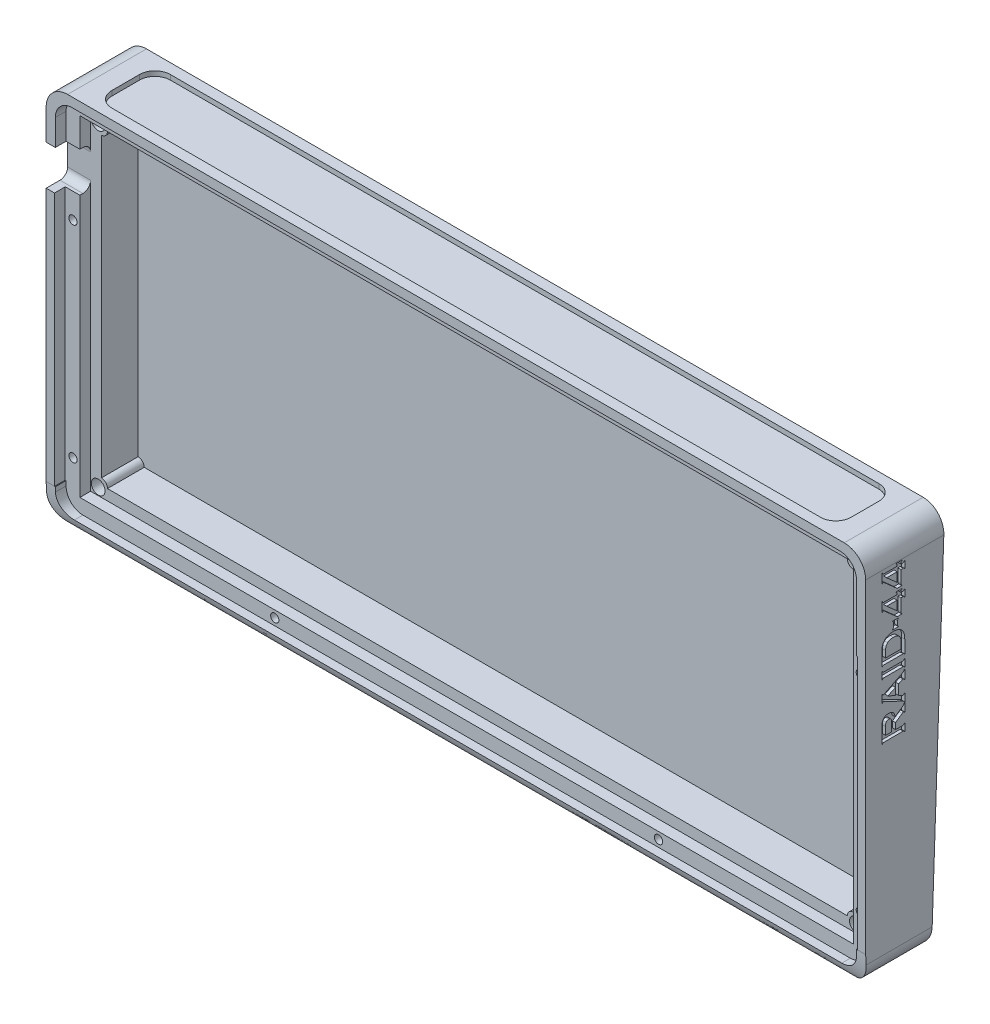
from build123d import *

# Parameters (mm, degrees)
SKETCH2_W           = 267.505
SKETCH2_H           = 122.92
SKETCH2_W_2         = 261.505
SKETCH2_H_2         = 116.92
BOSS_EXTRUDE1_DEPTH = 7
SKETCH3_W           = 267.505
SKETCH3_H           = 122.92
SKETCH3_W_2         = 245.505
SKETCH3_H_2         = 100.92
BOSS_EXTRUDE2_DEPTH = 12
SKETCH4_R           = 2.25
CUT_EXTRUDE1_DEPTH  = 6.1
SKETCH5_W           = 267.505
SKETCH5_H           = 122.92
BOSS_EXTRUDE3_DEPTH = 7
CHAMFER1_SIZE       = 4.539700034
CHAMFER1_SIZE_2     = 130
FILLET1_R           = 7
FILLET2_R           = 5.5
FILLET3_START       = -13
FILLET3_DEPTH       = 6.9
FILLET3_START_2     = -6.1
FILLET3_2_DEPTH     = 6.1
SKETCH6_W           = 3
SKETCH6_H           = 13
CUT_EXTRUDE2_DEPTH  = 7
FILLET4_R           = 2
BOSS_EXTRUDE4_START = 3.5
BOSS_EXTRUDE4_DEPTH = 3.5
FILLET6_SIZE        = 10
FILLET6_SIZE_2      = 2.5
SKETCH15_R          = 1.35
CUT_EXTRUDE5_DEPTH  = 6.1
FILLET7_R           = 2.5
CUT_EXTRUDE6_DEPTH  = 1.5875
CUT_EXTRUDE7_DEPTH  = 1
SKETCH18_W          = 0.273324365
SKETCH18_H          = 82.92
CUT_EXTRUDE8_DEPTH  = 3.5
BOSS_EXTRUDE5_START = -12
BOSS_EXTRUDE5_DEPTH = 12


with BuildPart() as part:
    # Sketch2 → Boss-Extrude1 (new body)
    with BuildSketch(Plane.XY):
        with Locations((-147.6225, -94.77)):
            Rectangle(SKETCH2_W, SKETCH2_H)
        with Locations((-147.6225, -94.77)):
            Rectangle(SKETCH2_W_2, SKETCH2_H_2, mode=Mode.SUBTRACT)
    extrude(amount=BOSS_EXTRUDE1_DEPTH)

    # Sketch3 → Boss-Extrude2 (add)
    with BuildSketch(Plane(origin=(0, 0, 0), x_dir=(-1, 0, 0), z_dir=(0, 0, -1))):
        with Locations((147.6225, -94.77)):
            Rectangle(SKETCH3_W, SKETCH3_H)
        with Locations((147.6225, -94.77)):
            Rectangle(SKETCH3_W_2, SKETCH3_H_2, mode=Mode.SUBTRACT)
    extrude(amount=BOSS_EXTRUDE2_DEPTH)

    # Sketch4 → Cut-Extrude1 (cut)
    with BuildSketch(Plane.XY):
        with Locations((-271.4, -43.3)):
            Circle(SKETCH4_R)
        with Locations((-23.9, -43.4)):
            Circle(SKETCH4_R)
        with Locations((-23.9, -146.3)):
            Circle(SKETCH4_R)
        with Locations((-271.4, -146.3)):
            Circle(SKETCH4_R)
    extrude(amount=-CUT_EXTRUDE1_DEPTH, mode=Mode.SUBTRACT)

    # Sketch5 → Boss-Extrude3 (add)
    with BuildSketch(Plane(origin=(0, 0, -12), x_dir=(-1, 0, 0), z_dir=(0, 0, -1))):
        with Locations((147.6225, -94.77)):
            Rectangle(SKETCH5_W, SKETCH5_H)
    extrude(amount=BOSS_EXTRUDE3_DEPTH)

    # Chamfer1
    # the kernel refuses this chamfer: 130, 4.539700034 mm, written as the material it takes off along each edge
    with BuildSketch(Plane(origin=(324.122385252, -156.23, -19), x_dir=(0, 0, 1), z_dir=(-1, 0, 0))) as chamfer1_piece_1:
        Polygon((CHAMFER1_SIZE, 0), (0, CHAMFER1_SIZE_2), (0, 0), align=None)
    extrude(amount=943.489770504, mode=Mode.SUBTRACT)

    # Fillet1
    fillet1_edges = [part.edges().sort_by_distance(p)[0] for p in [
        (-281.375, -33.31, -5.876380476),
        (-13.87, -33.31, -5.876380476),
        (-13.87, -156.23, -3.730149983),
        (-281.375, -156.23, -3.730149983),
    ]]
    fillet(fillet1_edges, radius=FILLET1_R)

    # Fillet2
    fillet2_edges = [part.edges().sort_by_distance(p)[0] for p in [
        (-278.375, -36.31, 3.5),
        (-278.375, -153.23, 3.5),
        (-16.87, -153.23, 3.5),
        (-16.87, -36.31, 3.5),
    ]]
    fillet(fillet2_edges, radius=FILLET2_R)

    # Fillet3: read off the stored shape, not the designer's step
    # Fillet3 outline → Fillet3 (add)
    with BuildSketch(Plane.XY.offset(FILLET3_START)):
        with BuildLine():
            Line((-270.375, -44.31), (-270.375, -46.31))
            ThreePointArc((-270.375, -46.31), (-269.789213562, -44.895786438), (-268.375, -44.31))
            Line((-268.375, -44.31), (-270.375, -44.31))
        make_face()
        with BuildLine():
            ThreePointArc((-268.375, -145.23), (-269.789213562, -144.644213562), (-270.375, -143.23))
            Line((-270.375, -143.23), (-270.375, -145.23))
            Line((-270.375, -145.23), (-268.375, -145.23))
        make_face()
        with BuildLine():
            ThreePointArc((-26.87, -44.31), (-25.455786438, -44.895786438), (-24.87, -46.31))
            Line((-24.87, -46.31), (-24.87, -44.31))
            Line((-24.87, -44.31), (-26.87, -44.31))
        make_face()
        with BuildLine():
            ThreePointArc((-24.87, -143.23), (-25.455786438, -144.644213562), (-26.87, -145.23))
            Line((-26.87, -145.23), (-24.87, -145.23))
            Line((-24.87, -145.23), (-24.87, -143.23))
        make_face()
    extrude(amount=FILLET3_DEPTH)

    # Fillet3 2 outline → Fillet3 2 (add)
    with BuildSketch(Plane.XY.offset(FILLET3_START_2)):
        with BuildLine():
            ThreePointArc((-269.389427942, -44.31), (-269.803074807, -44.8850331), (-270.375, -45.30296655))
            Line((-270.375, -45.30296655), (-270.375, -46.31))
            ThreePointArc((-270.375, -46.31), (-269.789213562, -44.895786438), (-268.375, -44.31))
            Line((-268.375, -44.31), (-269.389427942, -44.31))
        make_face()
        with BuildLine():
            ThreePointArc((-268.375, -145.23), (-269.789213562, -144.644213562), (-270.375, -143.23))
            Line((-270.375, -143.23), (-270.375, -144.29703345))
            ThreePointArc((-270.375, -144.29703345), (-269.827088541, -144.691134082), (-269.420707197, -145.23))
            Line((-269.420707197, -145.23), (-268.375, -145.23))
        make_face()
        with BuildLine():
            Line((-25.957765779, -44.31), (-26.87, -44.31))
            ThreePointArc((-26.87, -44.31), (-26.303534682, -44.391897541), (-25.78346148, -44.630882957))
            ThreePointArc((-25.78346148, -44.630882957), (-25.877134175, -44.473983452), (-25.957765779, -44.31))
        make_face()
        with BuildLine():
            ThreePointArc((-24.87, -143.23), (-25.455786438, -144.644213562), (-26.87, -145.23))
            Line((-26.87, -145.23), (-25.879292803, -145.23))
            ThreePointArc((-25.879292803, -145.23), (-25.450827125, -144.669835828), (-24.87, -144.269827594))
            Line((-24.87, -144.269827594), (-24.87, -143.23))
        make_face()
        with BuildLine():
            ThreePointArc((-24.87, -45.430172406), (-25.022837086, -45.349804318), (-25.169060644, -45.257951851))
            ThreePointArc((-25.169060644, -45.257951851), (-24.946217436, -45.763135626), (-24.87, -46.31))
            Line((-24.87, -46.31), (-24.87, -45.430172406))
        make_face()
    extrude(amount=FILLET3_2_DEPTH)

    # Sketch6 → Cut-Extrude2 (cut)
    with BuildSketch(Plane.XY):
        with Locations((-279.875, -56.81)):
            Rectangle(SKETCH6_W, SKETCH6_H)
    extrude(amount=CUT_EXTRUDE2_DEPTH, mode=Mode.SUBTRACT)

    # Fillet4
    fillet4_edges = [part.edges().sort_by_distance(p)[0] for p in [
        (-279.875, -50.31, 0),
        (-279.875, -63.31, 0),
    ]]
    fillet(fillet4_edges, radius=FILLET4_R)

    # Sketch13 → Boss-Extrude4 (add)
    with BuildSketch(Plane.XY.offset(BOSS_EXTRUDE4_START)):
        with BuildLine():
            Line((-21.37, -40.81), (-273.875, -40.81))
            Line((-273.875, -40.81), (-273.875, -50.31))
            Line((-273.875, -50.31), (-278.375, -50.31))
            Line((-278.375, -50.31), (-278.375, -41.81))
            ThreePointArc((-278.375, -41.81), (-276.764087297, -37.920912703), (-272.875, -36.31))
            Line((-272.875, -36.31), (-22.37, -36.31))
            ThreePointArc((-22.37, -36.31), (-18.480912703, -37.920912703), (-16.87, -41.81))
            Line((-16.87, -41.81), (-16.87, -147.73))
            ThreePointArc((-16.87, -147.73), (-18.480912703, -151.619087297), (-22.37, -153.23))
            Line((-22.37, -153.23), (-272.875, -153.23))
            ThreePointArc((-272.875, -153.23), (-276.764087297, -151.619087297), (-278.375, -147.73))
            Line((-278.375, -147.73), (-278.375, -63.31))
            Line((-278.375, -63.31), (-273.875, -63.31))
            Line((-273.875, -63.31), (-273.875, -148.73))
            Line((-273.875, -148.73), (-21.37, -148.73))
            Line((-21.37, -148.73), (-21.37, -40.81))
        make_face()
    extrude(amount=-BOSS_EXTRUDE4_DEPTH)

    # Fillet6
    # a fillet whose section is not a circle: 10, 2.5 mm, written as the material it takes off along each edge
    with BuildSketch(Plane(origin=(4.13, -156.23, 7), x_dir=(0, 1, 0), z_dir=(-1, 0, 0))) as fillet6_piece_1:
        with BuildLine():
            Bezier((FILLET6_SIZE, 0), (0, 0), (0, FILLET6_SIZE_2), weights=[1, 0.707106781, 1])
            Line((0, FILLET6_SIZE_2), (0, 0))
            Line((0, 0), (FILLET6_SIZE, 0))
        make_face()
    extrude(amount=303.505, mode=Mode.SUBTRACT)

    # Sketch15 → Cut-Extrude5 (cut)
    with BuildSketch(Plane.XY.offset(3.5)):
        with BuildLine():
            ThreePointArc((-277.475, -71.44217556), (-276.125, -72.79217556), (-274.775, -71.44217556))
            Line((-274.775, -71.44217556), (-277.475, -71.44217556))
        make_face()
        with BuildLine():
            Line((-277.475, -71.44217556), (-274.775, -71.44217556))
            ThreePointArc((-274.775, -71.44217556), (-276.125, -70.09217556), (-277.475, -71.44217556))
        make_face()
        with Locations((-276.125, -138.63)):
            Circle(SKETCH15_R)
        with Locations((-210.24875, -150.98)):
            Circle(SKETCH15_R)
        with Locations((-84.99625, -150.98)):
            Circle(SKETCH15_R)
        with Locations((-19.12, -138.63)):
            Circle(SKETCH15_R)
        with Locations((-19.12, -71.44217556)):
            Circle(SKETCH15_R)
    extrude(amount=-CUT_EXTRUDE5_DEPTH, mode=Mode.SUBTRACT)

    # Fillet7
    fillet7_edges = [part.edges().sort_by_distance(p)[0] for p in [
        (-276.125, -63.31, 0),
        (-276.125, -50.31, 0),
    ]]
    fillet(fillet7_edges, radius=FILLET7_R)

    # Sketch16 → Cut-Extrude6 (cut)
    with BuildSketch(Plane(origin=(0, -33.31, 0), x_dir=(1, 0, 0), z_dir=(0, 1, 0))):
        with BuildLine():
            Line((-263.2725, 15.401380476), (-31.9725, 15.401380476))
            ThreePointArc((-31.9725, 15.401380476), (-28.436966094, 13.936914382), (-26.9725, 10.401380476))
            Line((-26.9725, 10.401380476), (-26.9725, 1.351380476))
            ThreePointArc((-26.9725, 1.351380476), (-28.436966094, -2.18415343), (-31.9725, -3.648619524))
            Line((-31.9725, -3.648619524), (-263.2725, -3.648619524))
            ThreePointArc((-263.2725, -3.648619524), (-266.808033906, -2.18415343), (-268.2725, 1.351380476))
            Line((-268.2725, 1.351380476), (-268.2725, 10.401380476))
            ThreePointArc((-268.2725, 10.401380476), (-266.808033906, 13.936914382), (-263.2725, 15.401380476))
        make_face()
    extrude(amount=-CUT_EXTRUDE6_DEPTH, mode=Mode.SUBTRACT)

    # Sketch17 → Cut-Extrude7 (cut)
    # profile 1 of 7: a face of its own
    with BuildSketch(Plane(origin=(-13.87, 0, 0), x_dir=(0, 0, -1), z_dir=(1, 0, 0))):
        with BuildLine():
            Line((4.504157783, -43.1225), (4.504157783, -47.040143229))
            add(Edge.make_bspline(
                [(4.504157783, -47.040143229), (4.502119419, -47.127778077), (4.509745048, -47.2461695), (4.530623917, -47.385797048), (4.554947393, -47.456287037), (4.596606267, -47.508214501), (4.681479316, -47.564772932), (4.760097083, -47.588473668), (4.816657783, -47.601666667)],
                knots=[0, 0, 0, 0, 0.361677301, 0.489181471, 0.582838903, 0.665801133, 0.759082322, 1, 1, 1, 1], degree=3))
            Line((4.816657783, -47.601666667), (4.816657783, -47.81))
            Line((4.816657783, -47.81), (3.254157783, -47.81))
            Line((3.254157783, -47.81), (-0.904370863, -44.123476563))
            add(Edge.make_bspline(
                [(-0.904370863, -44.123476563), (-0.980283388, -44.057294651), (-1.102126141, -43.958176797), (-1.2443308, -43.883893339), (-1.303133884, -43.880963542)],
                knots=[0, 0, 0, 0, 0.636463643, 1, 1, 1, 1], degree=3))
            add(Edge.make_bspline(
                [(-1.303133884, -43.880963542), (-1.3626943, -43.877126045), (-1.492765987, -43.947280611), (-1.524460179, -44.091893892), (-1.537508884, -44.164166667)],
                knots=[0, 0, 0, 0, 0.428649318, 1, 1, 1, 1], degree=3))
            Line((-1.537508884, -44.164166667), (-1.745842217, -44.164166667))
            Line((-1.745842217, -44.164166667), (-1.745842217, -41.050559896))
            Line((-1.745842217, -41.050559896), (-1.537508884, -41.050559896))
            add(Edge.make_bspline(
                [(-1.537508884, -41.050559896), (-1.49874579, -41.170615181), (-1.452567569, -41.321441161), (-1.351726683, -41.472665888), (-1.271337543, -41.540185512), (-1.195520304, -41.561222352), (-1.14525628, -41.56)],
                knots=[0, 0, 0, 0, 0.551234789, 0.672737422, 0.783052467, 1, 1, 1, 1], degree=3))
            Line((-1.14525628, -41.56), (3.254157783, -41.56))
            Line((3.254157783, -41.56), (3.254157783, -41.190533854))
            add(Edge.make_bspline(
                [(3.254157783, -41.190533854), (3.253185783, -41.145221975), (3.247596424, -41.080201831), (3.217485134, -41.003028912), (3.185305641, -40.957667836), (3.142301741, -40.918865186), (3.063304371, -40.869753731), (2.992494478, -40.845200819), (2.941657783, -40.830833333)],
                knots=[0, 0, 0, 0, 0.260442349, 0.367642724, 0.470110976, 0.575544564, 0.696945433, 1, 1, 1, 1], degree=3))
            Line((2.941657783, -40.830833333), (2.941657783, -40.6225))
            Line((2.941657783, -40.6225), (4.816657783, -40.6225))
            Line((4.816657783, -40.6225), (4.816657783, -40.830833333))
            add(Edge.make_bspline(
                [(4.816657783, -40.830833333), (4.765632839, -40.843805699), (4.696433204, -40.87127602), (4.616219091, -40.918324582), (4.573043213, -40.95772344), (4.540821254, -41.003013584), (4.51072677, -41.080214574), (4.505125258, -41.145214416), (4.504157783, -41.190533854)],
                knots=[0, 0, 0, 0, 0.300290367, 0.424344735, 0.529798602, 0.632286563, 0.739507557, 1, 1, 1, 1], degree=3))
            Line((4.504157783, -41.190533854), (4.504157783, -41.56))
            Line((4.504157783, -41.56), (5.161709866, -41.56))
            add(Edge.make_bspline(
                [(5.161709866, -41.56), (5.209761035, -41.559363612), (5.2788657, -41.553114809), (5.36116702, -41.523482104), (5.411034785, -41.493046679), (5.453469045, -41.450200574), (5.502842583, -41.369054933), (5.532462168, -41.299472524), (5.545824449, -41.2475)],
                knots=[0, 0, 0, 0, 0.265582607, 0.377161355, 0.479164382, 0.584823043, 0.705847188, 1, 1, 1, 1], degree=3))
            Line((5.545824449, -41.2475), (5.754157783, -41.2475))
            Line((5.754157783, -41.2475), (5.754157783, -43.435))
            Line((5.754157783, -43.435), (5.545824449, -43.435))
            add(Edge.make_bspline(
                [(5.545824449, -43.435), (5.530999419, -43.383309141), (5.504418527, -43.311916743), (5.452890866, -43.232169748), (5.411145528, -43.189267531), (5.360785305, -43.159487211), (5.279876596, -43.125626771), (5.208972719, -43.125860617), (5.161709866, -43.1225)],
                knots=[0, 0, 0, 0, 0.29662784, 0.415067383, 0.520648771, 0.622577199, 0.735148944, 1, 1, 1, 1], degree=3))
            Line((5.161709866, -43.1225), (4.504157783, -43.1225))
        make_face()
        Polygon((3.254157783, -43.1225), (-0.147534926, -43.1225), (3.254157783, -46.138450521), align=None, mode=Mode.SUBTRACT)
    # profile 2 of 7: a face of its own
    with BuildSketch(Plane(origin=(-13.87, 0, 0), x_dir=(0, 0, -1), z_dir=(1, 0, 0))):
        with BuildLine():
            Line((4.504157783, -51.143333333), (4.504157783, -55.060976563))
            add(Edge.make_bspline(
                [(4.504157783, -55.060976563), (4.502119419, -55.14861141), (4.509745048, -55.267002834), (4.530623917, -55.406630381), (4.554947393, -55.47712037), (4.596606267, -55.529047835), (4.681479316, -55.585606265), (4.760097083, -55.609307001), (4.816657783, -55.6225)],
                knots=[0, 0, 0, 0, 0.361677301, 0.489181471, 0.582838903, 0.665801133, 0.759082322, 1, 1, 1, 1], degree=3))
            Line((4.816657783, -55.6225), (4.816657783, -55.830833333))
            Line((4.816657783, -55.830833333), (3.254157783, -55.830833333))
            Line((3.254157783, -55.830833333), (-0.904370863, -52.144309896))
            add(Edge.make_bspline(
                [(-0.904370863, -52.144309896), (-0.980283388, -52.078127985), (-1.102126141, -51.979010131), (-1.2443308, -51.904726673), (-1.303133884, -51.901796875)],
                knots=[0, 0, 0, 0, 0.636463643, 1, 1, 1, 1], degree=3))
            add(Edge.make_bspline(
                [(-1.303133884, -51.901796875), (-1.3626943, -51.897959378), (-1.492765987, -51.968113945), (-1.524460179, -52.112727225), (-1.537508884, -52.185)],
                knots=[0, 0, 0, 0, 0.428649318, 1, 1, 1, 1], degree=3))
            Line((-1.537508884, -52.185), (-1.745842217, -52.185))
            Line((-1.745842217, -52.185), (-1.745842217, -49.071393229))
            Line((-1.745842217, -49.071393229), (-1.537508884, -49.071393229))
            add(Edge.make_bspline(
                [(-1.537508884, -49.071393229), (-1.49874579, -49.191448514), (-1.452567569, -49.342274494), (-1.351726683, -49.493499222), (-1.271337543, -49.561018845), (-1.195520304, -49.582055685), (-1.14525628, -49.580833333)],
                knots=[0, 0, 0, 0, 0.551234789, 0.672737422, 0.783052467, 1, 1, 1, 1], degree=3))
            Line((-1.14525628, -49.580833333), (3.254157783, -49.580833333))
            Line((3.254157783, -49.580833333), (3.254157783, -49.211367188))
            add(Edge.make_bspline(
                [(3.254157783, -49.211367188), (3.253185783, -49.166055308), (3.247596424, -49.101035164), (3.217485134, -49.023862246), (3.185305641, -48.978501169), (3.142301741, -48.939698519), (3.063304371, -48.890587064), (2.992494478, -48.866034152), (2.941657783, -48.851666667)],
                knots=[0, 0, 0, 0, 0.260442349, 0.367642724, 0.470110976, 0.575544564, 0.696945433, 1, 1, 1, 1], degree=3))
            Line((2.941657783, -48.851666667), (2.941657783, -48.643333333))
            Line((2.941657783, -48.643333333), (4.816657783, -48.643333333))
            Line((4.816657783, -48.643333333), (4.816657783, -48.851666667))
            add(Edge.make_bspline(
                [(4.816657783, -48.851666667), (4.765632839, -48.864639032), (4.696433204, -48.892109353), (4.616219091, -48.939157915), (4.573043213, -48.978556774), (4.540821254, -49.023846917), (4.51072677, -49.101047908), (4.505125258, -49.16604775), (4.504157783, -49.211367188)],
                knots=[0, 0, 0, 0, 0.300290367, 0.424344735, 0.529798602, 0.632286563, 0.739507557, 1, 1, 1, 1], degree=3))
            Line((4.504157783, -49.211367188), (4.504157783, -49.580833333))
            Line((4.504157783, -49.580833333), (5.161709866, -49.580833333))
            add(Edge.make_bspline(
                [(5.161709866, -49.580833333), (5.209761035, -49.580196945), (5.2788657, -49.573948142), (5.36116702, -49.544315437), (5.411034785, -49.513880013), (5.453469045, -49.471033907), (5.502842583, -49.389888267), (5.532462168, -49.320305857), (5.545824449, -49.268333333)],
                knots=[0, 0, 0, 0, 0.265582607, 0.377161355, 0.479164382, 0.584823043, 0.705847188, 1, 1, 1, 1], degree=3))
            Line((5.545824449, -49.268333333), (5.754157783, -49.268333333))
            Line((5.754157783, -49.268333333), (5.754157783, -51.455833333))
            Line((5.754157783, -51.455833333), (5.545824449, -51.455833333))
            add(Edge.make_bspline(
                [(5.545824449, -51.455833333), (5.530999419, -51.404142475), (5.504418527, -51.332750077), (5.452890866, -51.253003081), (5.411145528, -51.210100864), (5.360785305, -51.180320544), (5.279876596, -51.146460104), (5.208972719, -51.14669395), (5.161709866, -51.143333333)],
                knots=[0, 0, 0, 0, 0.29662784, 0.415067383, 0.520648771, 0.622577199, 0.735148944, 1, 1, 1, 1], degree=3))
            Line((5.161709866, -51.143333333), (4.504157783, -51.143333333))
        make_face()
        Polygon((3.254157783, -51.143333333), (-0.147534926, -51.143333333), (3.254157783, -54.159283854), align=None, mode=Mode.SUBTRACT)
    # profile 3 of 7: a face of its own
    with BuildSketch(Plane(origin=(-13.87, 0, 0), x_dir=(0, 0, -1), z_dir=(1, 0, 0))):
        with BuildLine():
            Line((1.795824449, -56.351666667), (3.670824449, -56.351666667))
            Line((3.670824449, -56.351666667), (3.670824449, -56.56))
            add(Edge.make_bspline(
                [(3.670824449, -56.56), (3.619309711, -56.5752095), (3.54939903, -56.604449056), (3.468128278, -56.653992711), (3.425273556, -56.69641436), (3.394855359, -56.746287981), (3.364758476, -56.829586903), (3.359229097, -56.899942826), (3.358324449, -56.948997396)],
                knots=[0, 0, 0, 0, 0.293116289, 0.413310589, 0.518244765, 0.619548373, 0.730362043, 1, 1, 1, 1], degree=3))
            Line((3.358324449, -56.948997396), (3.358324449, -58.25921875))
            add(Edge.make_bspline(
                [(3.358324449, -58.25921875), (3.358950825, -58.307250745), (3.365226459, -58.376406791), (3.395076531, -58.459344069), (3.426412745, -58.510271662), (3.471650259, -58.551327897), (3.548357154, -58.606040549), (3.621072962, -58.628428262), (3.670824449, -58.643333333)],
                knots=[0, 0, 0, 0, 0.265482967, 0.377019853, 0.483102579, 0.590854687, 0.711019243, 1, 1, 1, 1], degree=3))
            Line((3.670824449, -58.643333333), (3.670824449, -58.851666667))
            Line((3.670824449, -58.851666667), (1.795824449, -58.851666667))
            Line((1.795824449, -58.851666667), (1.795824449, -58.643333333))
            add(Edge.make_bspline(
                [(1.795824449, -58.643333333), (1.845797923, -58.62740897), (1.91747824, -58.603008283), (1.997057512, -58.550852132), (2.040153118, -58.506191202), (2.071684118, -58.454496829), (2.10128679, -58.369185532), (2.107754033, -58.298622525), (2.108324449, -58.249453125)],
                knots=[0, 0, 0, 0, 0.285741809, 0.406595975, 0.512790059, 0.619837775, 0.732526505, 1, 1, 1, 1], degree=3))
            Line((2.108324449, -58.249453125), (2.108324449, -56.905052083))
            add(Edge.make_bspline(
                [(2.108324449, -56.905052083), (2.104680844, -56.855671353), (2.105614105, -56.782031383), (2.071328619, -56.697890779), (2.041590716, -56.646014173), (1.999235483, -56.602414351), (1.918810061, -56.551340847), (1.848093222, -56.523975592), (1.795824449, -56.511171875)],
                knots=[0, 0, 0, 0, 0.271710351, 0.384978719, 0.487571061, 0.593341152, 0.70964353, 1, 1, 1, 1], degree=3))
            Line((1.795824449, -56.511171875), (1.795824449, -56.351666667))
        make_face()
    # profile 4 of 7: a face of its own
    with BuildSketch(Plane(origin=(-13.87, 0, 0), x_dir=(0, 0, -1), z_dir=(1, 0, 0))):
        with BuildLine():
            Line((5.148689033, -67.289166667), (-1.140373467, -67.289166667))
            add(Edge.make_bspline(
                [(-1.140373467, -67.289166667), (-1.189359041, -67.292138088), (-1.262625152, -67.292732236), (-1.347031487, -67.325864413), (-1.39945012, -67.355377156), (-1.44113666, -67.399352988), (-1.495808022, -67.477526002), (-1.520034954, -67.550991546), (-1.537508884, -67.601666667)],
                knots=[0, 0, 0, 0, 0.26847059, 0.384327383, 0.486787545, 0.590330209, 0.70813246, 1, 1, 1, 1], degree=3))
            Line((-1.537508884, -67.601666667), (-1.745842217, -67.601666667))
            Line((-1.745842217, -67.601666667), (-1.745842217, -63.431744792))
            add(Edge.make_bspline(
                [(-1.745842217, -63.431744792), (-1.745770161, -63.216792555), (-1.737610456, -62.903717439), (-1.704438708, -62.500160325), (-1.670795186, -62.226924682), (-1.627077596, -61.973721519), (-1.558372801, -61.673156432), (-1.489264715, -61.460812678), (-1.433342217, -61.328880208)],
                knots=[0, 0, 0, 0, 0.301509718, 0.438953806, 0.567786705, 0.687508576, 0.799182941, 1, 1, 1, 1], degree=3))
            add(Edge.make_bspline(
                [(-1.433342217, -61.328880208), (-1.358316314, -61.15836358), (-1.227663373, -60.911999133), (-1.010756885, -60.614084742), (-0.830977542, -60.409762284), (-0.633104182, -60.222782819), (-0.33949459, -59.996988768), (-0.0974133, -59.855028358), (0.072191637, -59.772890625)],
                knots=[0, 0, 0, 0, 0.252577056, 0.376273615, 0.49871358, 0.620959077, 0.744657821, 1, 1, 1, 1], degree=3))
            add(Edge.make_bspline(
                [(0.072191637, -59.772890625), (0.211156222, -59.704521222), (0.42861089, -59.616097867), (0.731302213, -59.526314555), (0.968384041, -59.468293864), (1.215152775, -59.428005424), (1.558797438, -59.381470119), (1.822913315, -59.374501684), (2.000902574, -59.3725)],
                knots=[0, 0, 0, 0, 0.233815547, 0.35356111, 0.476561004, 0.602088669, 0.730938212, 1, 1, 1, 1], degree=3))
            add(Edge.make_bspline(
                [(2.000902574, -59.3725), (2.306556731, -59.370857134), (2.75381448, -59.405060595), (3.322091153, -59.532007277), (3.709311528, -59.659967616), (4.06759212, -59.827739752), (4.504931364, -60.104158634), (4.792165058, -60.364569833), (4.958259345, -60.560651042)],
                knots=[0, 0, 0, 0, 0.278517249, 0.406711118, 0.5297296, 0.649357614, 0.766202023, 1, 1, 1, 1], degree=3))
            add(Edge.make_bspline(
                [(4.958259345, -60.560651042), (5.099448751, -60.727434356), (5.288216009, -61.000649225), (5.468965494, -61.406237416), (5.559140074, -61.675782242), (5.61437121, -61.904833434), (5.651692409, -62.088895799), (5.684427502, -62.284231249), (5.710431945, -62.491654324), (5.729044348, -62.71052165), (5.74994306, -63.025035892), (5.752835398, -63.266809909), (5.754157783, -63.431744792)],
                knots=[0, 0, 0, 0, 0.215328153, 0.324358841, 0.436365759, 0.49467309, 0.556279229, 0.621271495, 0.689655423, 0.762061261, 0.837541427, 1, 1, 1, 1], degree=3))
            Line((5.754157783, -63.431744792), (5.754157783, -67.601666667))
            Line((5.754157783, -67.601666667), (5.545824449, -67.601666667))
            add(Edge.make_bspline(
                [(5.545824449, -67.601666667), (5.528514373, -67.550827273), (5.503856128, -67.477794145), (5.449536421, -67.398726715), (5.406193706, -67.355839664), (5.354195927, -67.326172268), (5.270598513, -67.292122634), (5.197566359, -67.292504058), (5.148689033, -67.289166667)],
                knots=[0, 0, 0, 0, 0.292055392, 0.409933462, 0.515635268, 0.618161375, 0.731356617, 1, 1, 1, 1], degree=3))
        make_face()
        with BuildLine():
            Line((4.504157783, -65.6225), (4.504157783, -63.57171875))
            add(Edge.make_bspline(
                [(4.504157783, -63.57171875), (4.501818074, -63.418178695), (4.498444299, -63.194966364), (4.468869493, -62.908653395), (4.439730361, -62.716354681), (4.403622529, -62.538620445), (4.341508381, -62.33086251), (4.285626476, -62.184508481), (4.235603095, -62.097109375)],
                knots=[0, 0, 0, 0, 0.30463852, 0.441961779, 0.570358491, 0.69018774, 0.801153393, 1, 1, 1, 1], degree=3))
            add(Edge.make_bspline(
                [(4.235603095, -62.097109375), (4.144282578, -61.924465269), (3.962639491, -61.690430487), (3.654541802, -61.444222228), (3.389271142, -61.293570796), (3.089670649, -61.178006696), (2.626469796, -61.067550114), (2.256648549, -61.037541373), (2.000902574, -61.039166667)],
                knots=[0, 0, 0, 0, 0.224566827, 0.336640393, 0.452554887, 0.574674625, 0.705363514, 1, 1, 1, 1], degree=3))
            add(Edge.make_bspline(
                [(2.000902574, -61.039166667), (1.812039908, -61.036975719), (1.536247836, -61.055526811), (1.182773458, -61.114530079), (0.942015545, -61.175555132), (0.72017045, -61.257718861), (0.449900915, -61.385727704), (0.268674121, -61.513132072), (0.160082262, -61.608828125)],
                knots=[0, 0, 0, 0, 0.287461624, 0.419895234, 0.545340574, 0.665058475, 0.779616095, 1, 1, 1, 1], degree=3))
            add(Edge.make_bspline(
                [(0.160082262, -61.608828125), (0.044994419, -61.713028487), (-0.109719089, -61.889014695), (-0.263302174, -62.159345626), (-0.352972737, -62.38096058), (-0.417415562, -62.629478649), (-0.483271311, -63.027371473), (-0.494138913, -63.347480763), (-0.495842217, -63.57171875)],
                knots=[0, 0, 0, 0, 0.217878263, 0.325594832, 0.434849295, 0.552271567, 0.685031851, 1, 1, 1, 1], degree=3))
            Line((-0.495842217, -63.57171875), (-0.495842217, -65.6225))
            Line((-0.495842217, -65.6225), (4.504157783, -65.6225))
        make_face(mode=Mode.SUBTRACT)
    # profile 5 of 7: a face of its own
    with BuildSketch(Plane(origin=(-13.87, 0, 0), x_dir=(0, 0, -1), z_dir=(1, 0, 0))):
        with BuildLine():
            Line((5.148689033, -70.935), (-1.14525628, -70.935))
            add(Edge.make_bspline(
                [(-1.14525628, -70.935), (-1.193087388, -70.938080559), (-1.264980076, -70.938348098), (-1.347420875, -70.97208773), (-1.399464574, -71.001174504), (-1.441132211, -71.045197396), (-1.495811928, -71.123349611), (-1.520032561, -71.196830836), (-1.537508884, -71.2475)],
                knots=[0, 0, 0, 0, 0.264923551, 0.379020974, 0.482364228, 0.586799314, 0.705616888, 1, 1, 1, 1], degree=3))
            Line((-1.537508884, -71.2475), (-1.745842217, -71.2475))
            Line((-1.745842217, -71.2475), (-1.745842217, -68.955833333))
            Line((-1.745842217, -68.955833333), (-1.537508884, -68.955833333))
            add(Edge.make_bspline(
                [(-1.537508884, -68.955833333), (-1.522010144, -69.006464246), (-1.497477564, -69.078720724), (-1.444993484, -69.158641237), (-1.40102652, -69.201440976), (-1.349111426, -69.232214502), (-1.264217933, -69.26046799), (-1.19404566, -69.268436451), (-1.14525628, -69.268333333)],
                knots=[0, 0, 0, 0, 0.288924188, 0.409945008, 0.51628553, 0.619431163, 0.735052585, 1, 1, 1, 1], degree=3))
            Line((-1.14525628, -69.268333333), (5.148689033, -69.268333333))
            add(Edge.make_bspline(
                [(5.148689033, -69.268333333), (5.198821278, -69.267460314), (5.270747224, -69.261807271), (5.356893322, -69.2315917), (5.409339801, -69.200281004), (5.452241299, -69.155568636), (5.506835367, -69.0779675), (5.529177294, -69.005255284), (5.545824449, -68.955833333)],
                knots=[0, 0, 0, 0, 0.27181956, 0.38389566, 0.490361412, 0.598028394, 0.715811623, 1, 1, 1, 1], degree=3))
            Line((5.545824449, -68.955833333), (5.754157783, -68.955833333))
            Line((5.754157783, -68.955833333), (5.754157783, -71.2475))
            Line((5.754157783, -71.2475), (5.545824449, -71.2475))
            add(Edge.make_bspline(
                [(5.545824449, -71.2475), (5.528514373, -71.196660607), (5.503856128, -71.123627478), (5.449536421, -71.044560048), (5.406193706, -71.001672997), (5.354195927, -70.972005601), (5.270598513, -70.937955967), (5.197566359, -70.938337391), (5.148689033, -70.935)],
                knots=[0, 0, 0, 0, 0.292055392, 0.409933462, 0.515635268, 0.618161375, 0.731356617, 1, 1, 1, 1], degree=3))
        make_face()
    # profile 6 of 7: a face of its own
    with BuildSketch(Plane(origin=(-13.87, 0, 0), x_dir=(0, 0, -1), z_dir=(1, 0, 0))):
        with BuildLine():
            Line((3.774991116, -75.078880208), (3.774991116, -78.356875))
            Line((3.774991116, -78.356875), (4.85083747, -78.895611979))
            add(Edge.make_bspline(
                [(4.85083747, -78.895611979), (4.915833105, -78.925716316), (5.030205878, -78.973584618), (5.151913712, -78.999086271), (5.204027574, -78.999778646)],
                knots=[0, 0, 0, 0, 0.580251822, 1, 1, 1, 1], degree=3))
            add(Edge.make_bspline(
                [(5.204027574, -78.999778646), (5.243228105, -79.001432426), (5.301004554, -78.988761357), (5.368929339, -78.950119976), (5.414955402, -78.910488842), (5.455241911, -78.85916911), (5.506826584, -78.772603279), (5.53064967, -78.696450797), (5.545824449, -78.643333333)],
                knots=[0, 0, 0, 0, 0.218825808, 0.323829056, 0.436129446, 0.557402244, 0.688486194, 1, 1, 1, 1], degree=3))
            Line((5.545824449, -78.643333333), (5.754157783, -78.643333333))
            Line((5.754157783, -78.643333333), (5.754157783, -81.143333333))
            Line((5.754157783, -81.143333333), (5.545824449, -81.143333333))
            add(Edge.make_bspline(
                [(5.545824449, -81.143333333), (5.532502977, -81.077571251), (5.505574865, -80.984126317), (5.446529781, -80.875172798), (5.392582441, -80.807488399), (5.321363227, -80.744074118), (5.180072543, -80.65360086), (5.058972228, -80.588497115), (4.96802497, -80.547630208)],
                knots=[0, 0, 0, 0, 0.23109441, 0.331298764, 0.424241311, 0.527271288, 0.657661792, 1, 1, 1, 1], degree=3))
            Line((4.96802497, -80.547630208), (-0.743238051, -77.800234375))
            add(Edge.make_bspline(
                [(-0.743238051, -77.800234375), (-0.823078427, -77.764037056), (-0.962165908, -77.699232331), (-1.113037866, -77.669445093), (-1.177808363, -77.668398438)],
                knots=[0, 0, 0, 0, 0.576554105, 1, 1, 1, 1], degree=3))
            add(Edge.make_bspline(
                [(-1.177808363, -77.668398438), (-1.257385557, -77.663753685), (-1.4266247, -77.736189553), (-1.507917361, -77.900167009), (-1.537508884, -77.987408854)],
                knots=[0, 0, 0, 0, 0.452935481, 1, 1, 1, 1], degree=3))
            Line((-1.537508884, -77.987408854), (-1.745842217, -77.987408854))
            Line((-1.745842217, -77.987408854), (-1.745842217, -75.324648438))
            Line((-1.745842217, -75.324648438), (-1.537508884, -75.324648438))
            add(Edge.make_bspline(
                [(-1.537508884, -75.324648438), (-1.511288625, -75.410471196), (-1.447732852, -75.572647854), (-1.291314368, -75.653891941), (-1.216870863, -75.648541667)],
                knots=[0, 0, 0, 0, 0.561853321, 1, 1, 1, 1], degree=3))
            add(Edge.make_bspline(
                [(-1.216870863, -75.648541667), (-1.159462087, -75.648324457), (-1.034401761, -75.626387321), (-0.918088183, -75.575952574), (-0.857170342, -75.544375)],
                knots=[0, 0, 0, 0, 0.454454738, 1, 1, 1, 1], degree=3))
            Line((-0.857170342, -75.544375), (4.87036872, -72.668398438))
            add(Edge.make_bspline(
                [(4.87036872, -72.668398438), (4.974431164, -72.614748871), (5.119828109, -72.541343618), (5.281313023, -72.426034494), (5.3677537, -72.352529616), (5.433804371, -72.273848588), (5.49931864, -72.150590287), (5.533683438, -72.049075633), (5.545824449, -71.976666667)],
                knots=[0, 0, 0, 0, 0.348022852, 0.480645632, 0.587818065, 0.683827148, 0.783228319, 1, 1, 1, 1], degree=3))
            Line((5.545824449, -71.976666667), (5.754157783, -71.976666667))
            Line((5.754157783, -71.976666667), (5.754157783, -74.789166667))
            Line((5.754157783, -74.789166667), (5.545824449, -74.789166667))
            add(Edge.make_bspline(
                [(5.545824449, -74.789166667), (5.53620304, -74.732672563), (5.516475813, -74.652395558), (5.470309079, -74.559052741), (5.431638561, -74.503476772), (5.382913736, -74.462123878), (5.307877082, -74.420948557), (5.242822044, -74.41013305), (5.199144762, -74.409934896)],
                knots=[0, 0, 0, 0, 0.304312852, 0.432771844, 0.549979676, 0.65996038, 0.767934728, 1, 1, 1, 1], degree=3))
            add(Edge.make_bspline(
                [(5.199144762, -74.409934896), (5.148760162, -74.409663854), (5.029316477, -74.440865433), (4.915917704, -74.487658291), (4.85083747, -74.520611979)],
                knots=[0, 0, 0, 0, 0.406461252, 1, 1, 1, 1], degree=3))
            Line((4.85083747, -74.520611979), (3.774991116, -75.078880208))
        make_face()
        Polygon((2.733324449, -75.560651042), (0.244717679, -76.708111979), (2.733324449, -77.860455729), align=None, mode=Mode.SUBTRACT)
    # profile 7 of 7: a face of its own
    with BuildSketch(Plane(origin=(-13.87, 0, 0), x_dir=(0, 0, -1), z_dir=(1, 0, 0))):
        with BuildLine():
            Line((2.733324449, -87.4975), (5.160082262, -87.4975))
            add(Edge.make_bspline(
                [(5.160082262, -87.4975), (5.208171176, -87.496924716), (5.277174693, -87.490512168), (5.360324551, -87.460852915), (5.411039846, -87.428830809), (5.454157882, -87.385314194), (5.50511898, -87.305632347), (5.533295258, -87.236371799), (5.545824449, -87.185)],
                knots=[0, 0, 0, 0, 0.265034555, 0.37638305, 0.482286599, 0.591944849, 0.710226487, 1, 1, 1, 1], degree=3))
            Line((5.545824449, -87.185), (5.754157783, -87.185))
            Line((5.754157783, -87.185), (5.754157783, -89.476666667))
            Line((5.754157783, -89.476666667), (5.545824449, -89.476666667))
            add(Edge.make_bspline(
                [(5.545824449, -89.476666667), (5.52853817, -89.425787245), (5.503817284, -89.352859484), (5.449581002, -89.273651726), (5.406380735, -89.231413305), (5.355584644, -89.200671944), (5.273066025, -89.167848796), (5.201540614, -89.167046966), (5.153571845, -89.164166667)],
                knots=[0, 0, 0, 0, 0.294504533, 0.413371115, 0.519959324, 0.620822695, 0.734967178, 1, 1, 1, 1], degree=3))
            Line((5.153571845, -89.164166667), (-1.140373467, -89.164166667))
            add(Edge.make_bspline(
                [(-1.140373467, -89.164166667), (-1.189359041, -89.167138088), (-1.262625152, -89.167732236), (-1.347031487, -89.200864413), (-1.39945012, -89.230377156), (-1.44113666, -89.274352988), (-1.495808022, -89.352526002), (-1.520034954, -89.425991546), (-1.537508884, -89.476666667)],
                knots=[0, 0, 0, 0, 0.26847059, 0.384327383, 0.486787545, 0.590330209, 0.70813246, 1, 1, 1, 1], degree=3))
            Line((-1.537508884, -89.476666667), (-1.745842217, -89.476666667))
            Line((-1.745842217, -89.476666667), (-1.745842217, -84.828229167))
            add(Edge.make_bspline(
                [(-1.745842217, -84.828229167), (-1.74429462, -84.574289797), (-1.738117079, -84.214026851), (-1.694821874, -83.764959401), (-1.653627991, -83.48822415), (-1.594060543, -83.241365066), (-1.492004791, -82.944108067), (-1.384754495, -82.737945599), (-1.30150628, -82.611432292)],
                knots=[0, 0, 0, 0, 0.332218969, 0.470501829, 0.589698608, 0.697751823, 0.802072827, 1, 1, 1, 1], degree=3))
            add(Edge.make_bspline(
                [(-1.30150628, -82.611432292), (-1.207865915, -82.471132172), (-0.979784392, -82.213375184), (-0.683692475, -82.037949139), (-0.526766696, -81.97015625)],
                knots=[0, 0, 0, 0, 0.496544587, 1, 1, 1, 1], degree=3))
            add(Edge.make_bspline(
                [(-0.526766696, -81.97015625), (-0.369417019, -81.904462325), (-0.038337524, -81.798975808), (0.307891741, -81.769597195), (0.482347887, -81.768333333)],
                knots=[0, 0, 0, 0, 0.494188948, 1, 1, 1, 1], degree=3))
            add(Edge.make_bspline(
                [(0.482347887, -81.768333333), (0.627811771, -81.767652575), (0.841146386, -81.784066188), (1.115031769, -81.836029573), (1.303633917, -81.891721639), (1.480451976, -81.963403476), (1.645068615, -82.051462872), (1.79807314, -82.154786765), (1.938770627, -82.27442431), (2.067880022, -82.410402997), (2.18507159, -82.562023114), (2.290097114, -82.729997218), (2.382398092, -82.913730759), (2.461715377, -83.113388806), (2.555991795, -83.407525077), (2.603380521, -83.64069346), (2.629157783, -83.801210938)],
                knots=[0, 0, 0, 0, 0.132813402, 0.194929055, 0.254368759, 0.312171913, 0.368939358, 0.424616554, 0.48052932, 0.537324889, 0.595621093, 0.655306215, 0.718037796, 0.783203153, 0.85138991, 1, 1, 1, 1], degree=3))
            Line((2.629157783, -83.801210938), (4.69458747, -82.349388021))
            add(Edge.make_bspline(
                [(4.69458747, -82.349388021), (4.776329516, -82.291652281), (4.890533093, -82.204296423), (5.036237709, -82.093974296), (5.127515018, -82.02081811), (5.206545616, -81.953267128), (5.273924849, -81.892556242), (5.330026885, -81.838437162), (5.389218079, -81.775917111), (5.447863349, -81.695509397), (5.516605505, -81.551678348), (5.541932283, -81.432948573), (5.545824449, -81.351666667)],
                knots=[0, 0, 0, 0, 0.220562266, 0.316968925, 0.402893527, 0.478396623, 0.546140146, 0.602810871, 0.650202368, 0.735851824, 0.82090628, 1, 1, 1, 1], degree=3))
            Line((5.545824449, -81.351666667), (5.754157783, -81.351666667))
            Line((5.754157783, -81.351666667), (5.754157783, -84.019309896))
            Line((5.754157783, -84.019309896), (5.545824449, -84.019309896))
            add(Edge.make_bspline(
                [(5.545824449, -84.019309896), (5.531186928, -83.950096658), (5.512623652, -83.818156719), (5.403429136, -83.741248443), (5.352139554, -83.742617188)],
                knots=[0, 0, 0, 0, 0.603053351, 1, 1, 1, 1], degree=3))
            add(Edge.make_bspline(
                [(5.352139554, -83.742617188), (5.292819852, -83.750646246), (5.132251689, -83.831124141), (4.985480684, -83.929981095), (4.886644762, -83.996523438)],
                knots=[0, 0, 0, 0, 0.331909727, 1, 1, 1, 1], degree=3))
            Line((4.886644762, -83.996523438), (2.733324449, -85.510195313))
            Line((2.733324449, -85.510195313), (2.733324449, -87.4975))
        make_face()
        with BuildLine():
            Line((1.483324449, -87.4975), (1.483324449, -85.028424479))
            add(Edge.make_bspline(
                [(1.483324449, -85.028424479), (1.483151264, -84.872736911), (1.482499, -84.659183402), (1.465820678, -84.402076626), (1.440991687, -84.155635131), (1.384482252, -83.970990652), (1.312426012, -83.843528646)],
                knots=[0, 0, 0, 0, 0.386120835, 0.52900855, 0.638629497, 1, 1, 1, 1], degree=3))
            add(Edge.make_bspline(
                [(1.312426012, -83.843528646), (1.277352639, -83.776443897), (1.207180426, -83.687800721), (1.092145375, -83.591032182), (0.993189894, -83.535249495), (0.885184196, -83.488066308), (0.71801166, -83.447121556), (0.585559819, -83.434395399), (0.493741116, -83.435)],
                knots=[0, 0, 0, 0, 0.234598843, 0.348597936, 0.465952837, 0.587077932, 0.714518796, 1, 1, 1, 1], degree=3))
            add(Edge.make_bspline(
                [(0.493741116, -83.435), (0.401922413, -83.434395399), (0.269470572, -83.447121556), (0.102298036, -83.488066308), (-0.005707662, -83.535249495), (-0.104663142, -83.591032182), (-0.219698194, -83.687800721), (-0.289870407, -83.776443897), (-0.32494378, -83.843528646)],
                knots=[0, 0, 0, 0, 0.285481204, 0.412922068, 0.534047163, 0.651402064, 0.765401157, 1, 1, 1, 1], degree=3))
            add(Edge.make_bspline(
                [(-0.32494378, -83.843528646), (-0.399444235, -83.968890144), (-0.459819195, -84.152014536), (-0.481699856, -84.397214428), (-0.491831975, -84.655597954), (-0.497774667, -84.870468597), (-0.495842217, -85.028424479)],
                knots=[0, 0, 0, 0, 0.3598338, 0.467829492, 0.609030206, 1, 1, 1, 1], degree=3))
            Line((-0.495842217, -85.028424479), (-0.495842217, -87.4975))
            Line((-0.495842217, -87.4975), (1.483324449, -87.4975))
        make_face(mode=Mode.SUBTRACT)
    extrude(amount=-CUT_EXTRUDE7_DEPTH, mode=Mode.SUBTRACT)

    # Sketch18 → Cut-Extrude8 (cut)
    with BuildSketch(Plane.XY.offset(7)):
        with Locations((-278.511662183, -104.77)):
            Rectangle(SKETCH18_W, SKETCH18_H)
        with Locations((-16.733337818, -104.77)):
            Rectangle(SKETCH18_W, SKETCH18_H)
    extrude(amount=-CUT_EXTRUDE8_DEPTH, mode=Mode.SUBTRACT)

    # Sketch19 → Boss-Extrude5 (add)
    with BuildSketch(Plane.XY.offset(BOSS_EXTRUDE5_START)):
        with BuildLine():
            ThreePointArc((-270.375, -143.23), (-268.960786438, -143.815786438), (-268.375, -145.23))
            ThreePointArc((-268.375, -145.23), (-269.789213562, -144.644213562), (-270.375, -143.23))
        make_face()
        with BuildLine():
            ThreePointArc((-270.375, -46.31), (-268.960786438, -45.724213562), (-268.375, -44.31))
            ThreePointArc((-268.375, -44.31), (-269.789213562, -44.895786438), (-270.375, -46.31))
        make_face()
        with BuildLine():
            ThreePointArc((-26.87, -44.31), (-26.284213562, -45.724213562), (-24.87, -46.31))
            ThreePointArc((-24.87, -46.31), (-25.455786438, -44.895786438), (-26.87, -44.31))
        make_face()
        with BuildLine():
            ThreePointArc((-26.87, -145.23), (-26.284213562, -143.815786438), (-24.87, -143.23))
            ThreePointArc((-24.87, -143.23), (-25.455786438, -144.644213562), (-26.87, -145.23))
        make_face()
    extrude(amount=BOSS_EXTRUDE5_DEPTH)


solid = part.part
